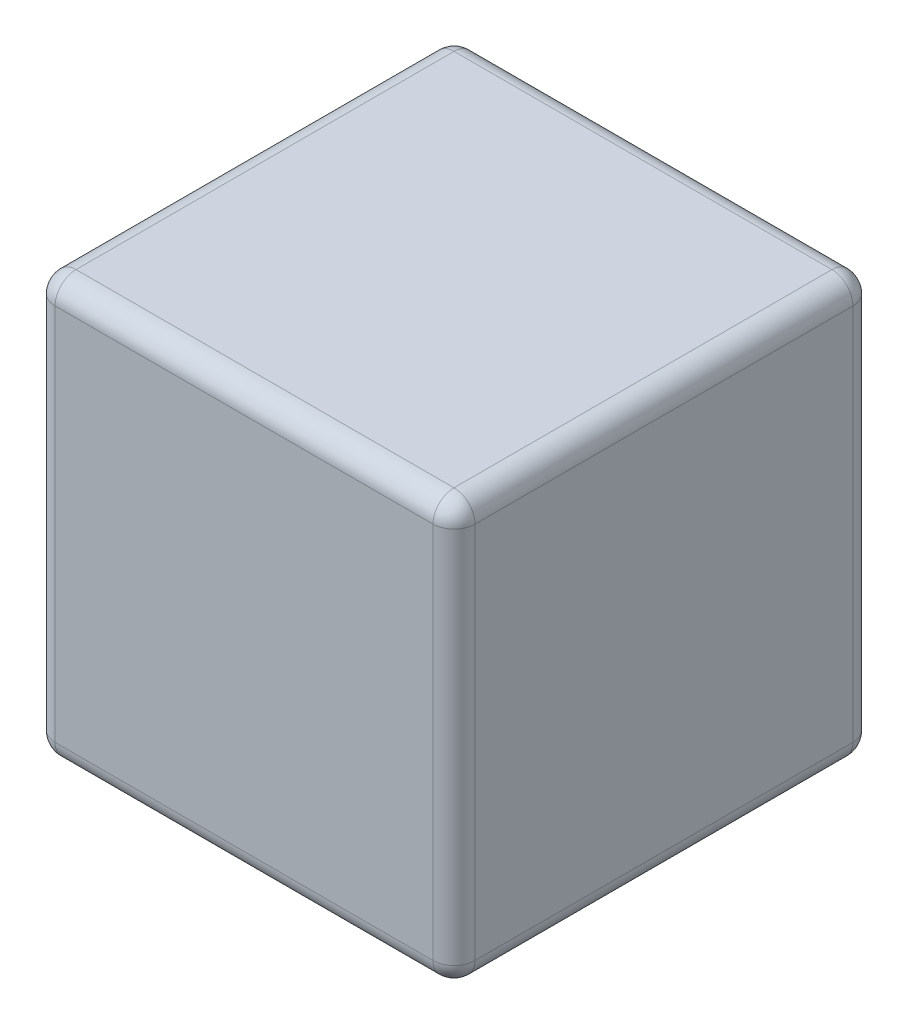
from build123d import *

# Parameters (mm, degrees)
SKETCH1_W           = 20
SKETCH1_H           = 20
BOSS_EXTRUDE1_DEPTH = 20
FILLET1_R           = 1


with BuildPart() as part:
    # Sketch1 → Boss-Extrude1 (new body)
    with BuildSketch(Plane(origin=(0, 0, 0), x_dir=(1, 0, 0), z_dir=(0, 1, 0))):
        with Locations((10, 10)):
            Rectangle(SKETCH1_W, SKETCH1_H)
    extrude(amount=BOSS_EXTRUDE1_DEPTH)

    # Fillet1
    fillet1_edges = [part.edges().sort_by_distance(p)[0] for p in [
        (20, 10, -20),
        (20, 0, -10),
        (10, 0, 0),
        (0, 10, 0),
        (20, 10, 0),
        (20, 20, -10),
        (10, 20, 0),
        (0, 0, -10),
        (10, 0, -20),
        (0, 10, -20),
        (0, 20, -10),
        (10, 20, -20),
    ]]
    fillet(fillet1_edges, radius=FILLET1_R)


solid = part.part
